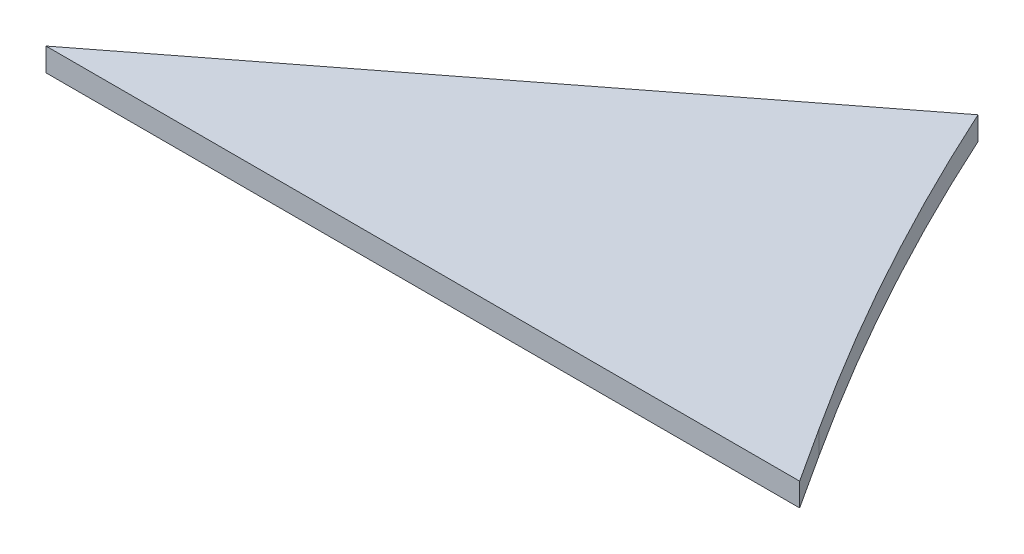
from build123d import *

# Parameters (mm, degrees)
BASE_FLANGE1_DEPTH = 2.54


# Sheet-metal steps are written as plain solids
with BuildPart() as part:
    # Sketch1 → Base-Flange1 (new body)
    with BuildSketch(Plane(origin=(0, 0, 0), x_dir=(1, 0, 0), z_dir=(0, 1, 0))):
        with BuildLine():
            Line((0, 0), (-57.470107897, -44.45))
            Line((-57.470107897, -44.45), (24.946370193, -44.45))
            Line((24.946370193, -44.45), (21.037356808, -38.407585285))
            ThreePointArc((21.037356808, -38.407585285), (9.816398094, -19.588459404), (0, 0))
        make_face()
    extrude(amount=-BASE_FLANGE1_DEPTH)


solid = part.part
